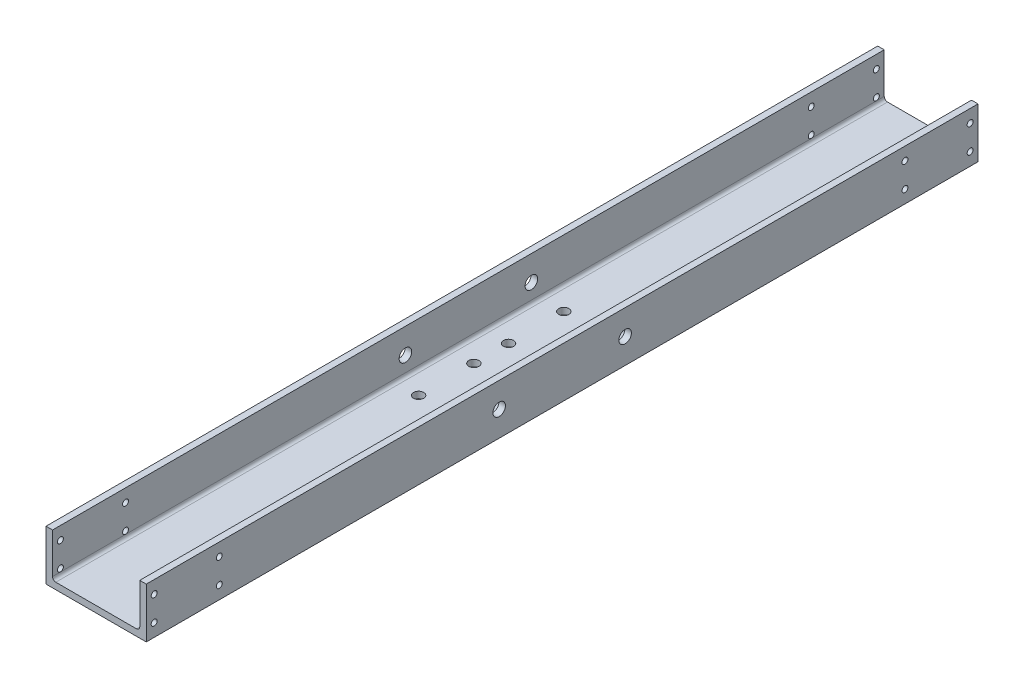
from build123d import *

# Parameters (mm, degrees)
BOSS_EXTRUDE1_DEPTH = 210.695
FILLET1_R           = 1.651
SKETCH4_R           = 2.585
CUT_EXTRUDE1_DEPTH  = 10
SKETCH9_R           = 3.18
CUT_EXTRUDE2_DEPTH  = 30
SKETCH10_R          = 1.5
CUT_EXTRUDE3_DEPTH  = 30


with BuildPart() as part:
    # Sketch3 → Boss-Extrude1 (new, symmetric)
    with BuildSketch(Plane.XY):
        Polygon((-25.4, 12.7), (-25.4, -12.7), (25.4, -12.7), (25.4, 12.7), (22.098, 12.7), (22.098, -9.398), (-22.098, -9.398), (-22.098, 12.7), align=None)
    extrude(amount=BOSS_EXTRUDE1_DEPTH, both=True)

    # Fillet1
    fillet1_edges = [part.edges().sort_by_distance(p)[0] for p in [
        (22.098, -9.398, 0),
        (-22.098, -9.398, 0),
    ]]
    fillet(fillet1_edges, radius=FILLET1_R)

    # Sketch4 → Cut-Extrude1 (cut)
    with BuildSketch(Plane(origin=(0, -9.398, 0), x_dir=(1, 0, 0), z_dir=(0, 1, 0))):
        with Locations((-10.530435142, 8.79)):
            Circle(SKETCH4_R)
        with Locations((10.469564858, 8.79)):
            Circle(SKETCH4_R)
        with Locations((-10.530435142, 36.79)):
            Circle(SKETCH4_R)
        with Locations((10.469564858, 36.79)):
            Circle(SKETCH4_R)
        with Locations((-10.530435142, -36.79)):
            Circle(SKETCH4_R)
        with Locations((10.469564858, -36.79)):
            Circle(SKETCH4_R)
        with Locations((10.469564858, -8.79)):
            Circle(SKETCH4_R)
        with Locations((-10.530435142, -8.79)):
            Circle(SKETCH4_R)
    extrude(amount=-CUT_EXTRUDE1_DEPTH, mode=Mode.SUBTRACT)

    # Sketch9 → Cut-Extrude2 (cut, symmetric)
    with BuildSketch(Plane(origin=(0, 0, 0), x_dir=(0, 0, -1), z_dir=(1, 0, 0))):
        with Locations((-31.91, 0)):
            Circle(SKETCH9_R)
        with Locations((31.91, 0)):
            Circle(SKETCH9_R)
    extrude(amount=CUT_EXTRUDE2_DEPTH, both=True, mode=Mode.SUBTRACT)

    # Sketch10 → Cut-Extrude3 (cut, symmetric)
    with BuildSketch(Plane(origin=(0, 0, 0), x_dir=(0, 0, -1), z_dir=(1, 0, 0))):
        with Locations((-206.695, 6.2)):
            Circle(SKETCH10_R)
        with Locations((-206.695, -6.2)):
            Circle(SKETCH10_R)
        with Locations((-173.695, 6.2)):
            Circle(SKETCH10_R)
        with Locations((-173.695, -6.2)):
            Circle(SKETCH10_R)
        with Locations((173.695, 6.2)):
            Circle(SKETCH10_R)
        with Locations((173.695, -6.2)):
            Circle(SKETCH10_R)
        with Locations((206.695, -6.2)):
            Circle(SKETCH10_R)
        with Locations((206.695, 6.2)):
            Circle(SKETCH10_R)
    extrude(amount=CUT_EXTRUDE3_DEPTH, both=True, mode=Mode.SUBTRACT)


solid = part.part
